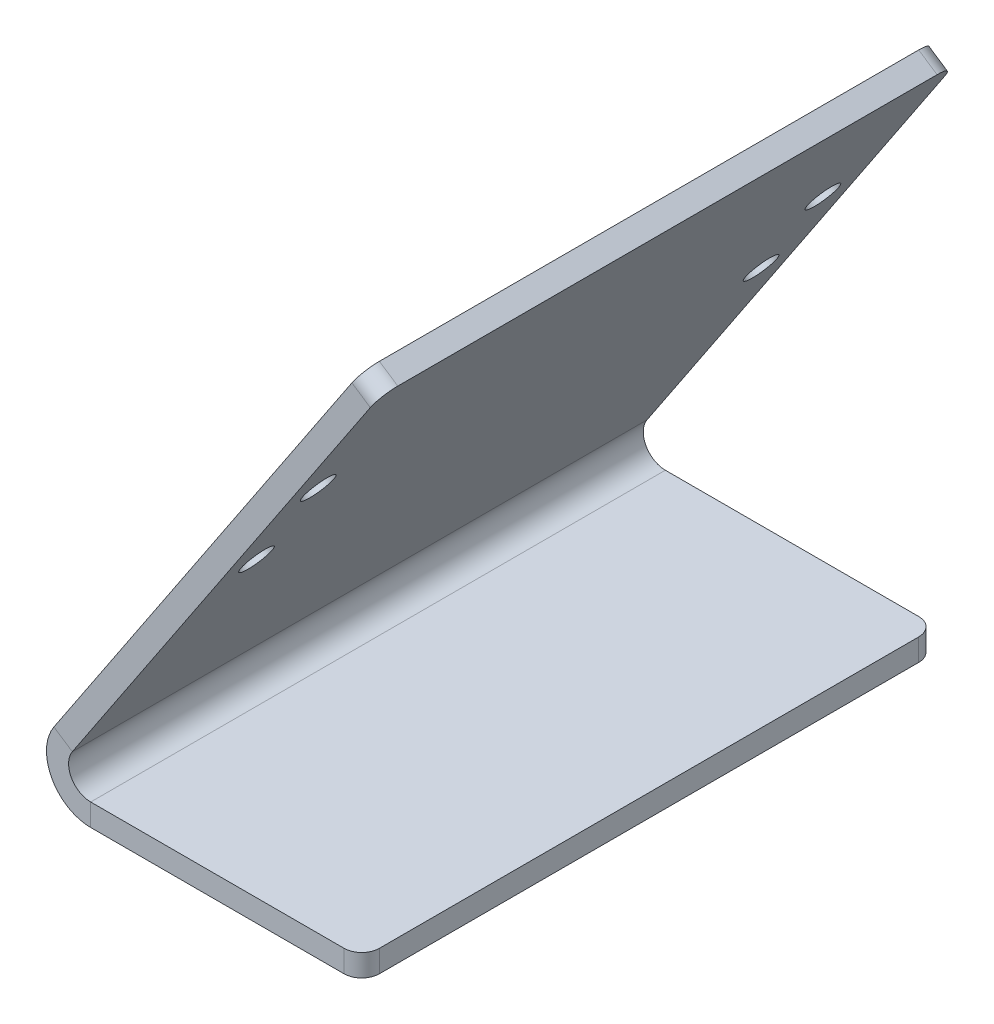
from build123d import *

# Parameters (mm, degrees)
BOSS_EXTRUDE1_DEPTH    = 41.275
CONVERT_SOLID1_START   = -41.275
CONVERT_SOLID1_DEPTH   = 82.55
CONVERT_SOLID1_2_DEPTH = 82.55
CUT_EXTRUDE1_REACH     = 64.782
SKETCH6_R              = 2.2479
FILLET1_R              = 2.54


# Read off the part's stored shape, not the designer's step: Convert-Solid1
with BuildPart() as part:
    # Sketch1 → Boss-Extrude1 (new, symmetric)
    with BuildSketch(Plane.XY):
        Polygon((25.4, -38.1), (-25.4, -38.1), (25.4, 38.1), align=None)
    extrude(amount=BOSS_EXTRUDE1_DEPTH, both=True)

    # Convert-Solid1 outline → Convert-Solid1 (cut)
    with BuildSketch(Plane.XY.offset(CONVERT_SOLID1_START)):
        with BuildLine():
            Line((25.4, -34.925), (25.4, 32.37618735))
            Line((25.4, 32.37618735), (-16.176676151, -29.988826877))
            ThreePointArc((-16.176676151, -29.988826877), (-16.334233318, -33.248148914), (-13.534916467, -34.925))
            Line((-13.534916467, -34.925), (25.4, -34.925))
        make_face()
        with BuildLine():
            ThreePointArc((-13.534916467, -38.1), (-19.133550169, -34.746297827), (-18.818435836, -28.227653754))
            Line((-18.818435836, -28.227653754), (-25.4, -38.1))
            Line((-25.4, -38.1), (-13.534916467, -38.1))
        make_face()
    extrude(amount=CONVERT_SOLID1_DEPTH, mode=Mode.SUBTRACT)

    # Convert-Solid1 2 outline → Convert-Solid1 2 (add)
    with BuildSketch(Plane.XY.offset(CONVERT_SOLID1_START)):
        Polygon((28.041759685, 36.338826877), (25.4, 38.1), (25.4, 32.37618735), align=None)
    extrude(amount=CONVERT_SOLID1_2_DEPTH)

    # Sketch6 → Cut-Extrude1 (cut, up to next)
    with BuildSketch(Plane(origin=(0, 0, 0), x_dir=(0, 0, 1), z_dir=(-0.8320502943378438, 0.554700196225229, 0)), mode=Mode.PRIVATE) as cut_extrude1_sk1:
        with Locations(Location((-36.2458, 20.701, 0), (0, 0, 270))):
            Circle(SKETCH6_R)
    cut_extrude1_tool1 = extrude(cut_extrude1_sk1.sketch, amount=-CUT_EXTRUDE1_REACH, mode=Mode.PRIVATE) & part.part
    # Sketch6 → Cut-Extrude1 (cut, up to next)
    with BuildSketch(Plane(origin=(0, 0, 0), x_dir=(0, 0, 1), z_dir=(-0.8320502943378438, 0.554700196225229, 0)), mode=Mode.PRIVATE) as cut_extrude1_sk2:
        with Locations(Location((36.2458, 20.701, 0), (0, 0, 270))):
            Circle(SKETCH6_R)
    cut_extrude1_tool2 = extrude(cut_extrude1_sk2.sketch, amount=-CUT_EXTRUDE1_REACH, mode=Mode.PRIVATE) & part.part
    # Sketch6 → Cut-Extrude1 (cut, up to next)
    with BuildSketch(Plane(origin=(0, 0, 0), x_dir=(0, 0, 1), z_dir=(-0.8320502943378438, 0.554700196225229, 0)), mode=Mode.PRIVATE) as cut_extrude1_sk3:
        with Locations(Location((-36.2458, 4.699, 0), (0, 0, 270))):
            Circle(SKETCH6_R)
    cut_extrude1_tool3 = extrude(cut_extrude1_sk3.sketch, amount=-CUT_EXTRUDE1_REACH, mode=Mode.PRIVATE) & part.part
    # Sketch6 → Cut-Extrude1 (cut, up to next)
    with BuildSketch(Plane(origin=(0, 0, 0), x_dir=(0, 0, 1), z_dir=(-0.8320502943378438, 0.554700196225229, 0)), mode=Mode.PRIVATE) as cut_extrude1_sk4:
        with Locations(Location((36.2458, 4.699, 0), (0, 0, 270))):
            Circle(SKETCH6_R)
    cut_extrude1_tool4 = extrude(cut_extrude1_sk4.sketch, amount=-CUT_EXTRUDE1_REACH, mode=Mode.PRIVATE) & part.part
    add(cut_extrude1_tool1.solids().sort_by_distance((11.482849, 17.224273, -36.2458))[0], mode=Mode.SUBTRACT)
    add(cut_extrude1_tool2.solids().sort_by_distance((11.482849, 17.224273, 36.2458))[0], mode=Mode.SUBTRACT)
    add(cut_extrude1_tool3.solids().sort_by_distance((2.606536, 3.909804, -36.2458))[0], mode=Mode.SUBTRACT)
    add(cut_extrude1_tool4.solids().sort_by_distance((2.606536, 3.909804, 36.2458))[0], mode=Mode.SUBTRACT)

    # Fillet1
    fillet1_edges = [part.edges().sort_by_distance(p)[0] for p in [
        (26.720879842, 37.219413438, -41.275),
        (26.720879842, 37.219413438, 41.275),
        (25.4, -36.5125, 41.275),
        (25.4, -36.5125, -41.275),
    ]]
    fillet(fillet1_edges, radius=FILLET1_R)


solid = part.part
